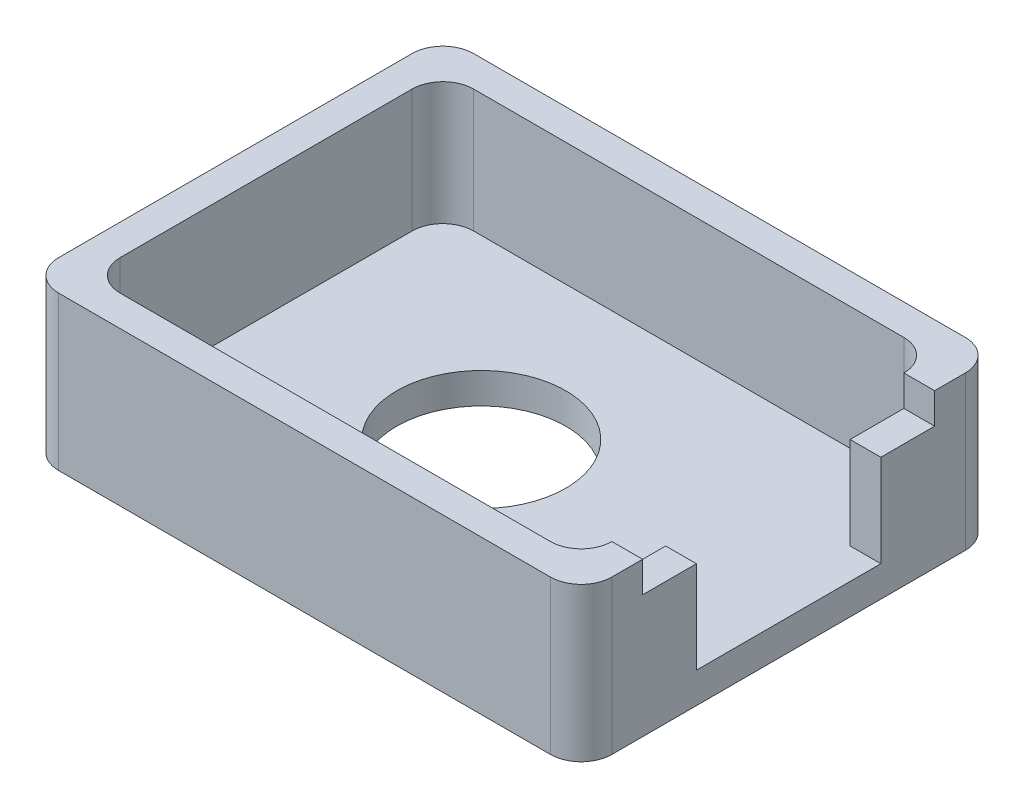
from build123d import *

# Parameters (mm, degrees)
SKETCH1_W           = 36
SKETCH1_H           = 27
SKETCH1_R           = 5.5
BOSS_EXTRUDE1_DEPTH = 2
BOSS_EXTRUDE2_DEPTH = 8
SKETCH3_W           = 3.5
SKETCH3_H           = 6
BOSS_EXTRUDE3_DEPTH = 2
FILLET2_R           = 2


with BuildPart() as part:
    # Sketch1 → Boss-Extrude1 (new body)
    with BuildSketch(Plane(origin=(0, 0, 0), x_dir=(1, 0, 0), z_dir=(0, 1, 0))):
        Rectangle(SKETCH1_W, SKETCH1_H)
        with Locations(Location((-2, 0, 0), (0, 0, 270))):
            Circle(SKETCH1_R, mode=Mode.SUBTRACT)
    extrude(amount=BOSS_EXTRUDE1_DEPTH)

    # Sketch2 → Boss-Extrude2 (add)
    with BuildSketch(Plane(origin=(0, 2, 0), x_dir=(1, 0, 0), z_dir=(0, 1, 0))):
        Polygon((18, 13.5), (-18, 13.5), (-18, -13.5), (18, -13.5), (18, -9.5), (16, -9.5), (16, -11.5), (-16, -11.5), (-16, 11.5), (16, 11.5), (16, 9.5), (18, 9.5), align=None)
    extrude(amount=BOSS_EXTRUDE2_DEPTH)

    # Sketch3 → Boss-Extrude3 (add)
    with BuildSketch(Plane(origin=(18, 0, 0), x_dir=(0, 0, -1), z_dir=(1, 0, 0))):
        with Locations((-7.75, 5)):
            Rectangle(SKETCH3_W, SKETCH3_H)
        with Locations((7.75, 5)):
            Rectangle(SKETCH3_W, SKETCH3_H)
    extrude(amount=-BOSS_EXTRUDE3_DEPTH)

    # Fillet2
    fillet2_edges = [part.edges().sort_by_distance(p)[0] for p in [
        (-18, 5, 13.5),
        (-18, 5, -13.5),
        (18, 5, -13.5),
        (18, 5, 13.5),
        (16, 6, -11.5),
        (16, 6, 11.5),
        (-16, 6, 11.5),
        (-16, 6, -11.5),
    ]]
    fillet(fillet2_edges, radius=FILLET2_R - 0.0001)  # a hair under: the kernel refuses the full size


solid = part.part
